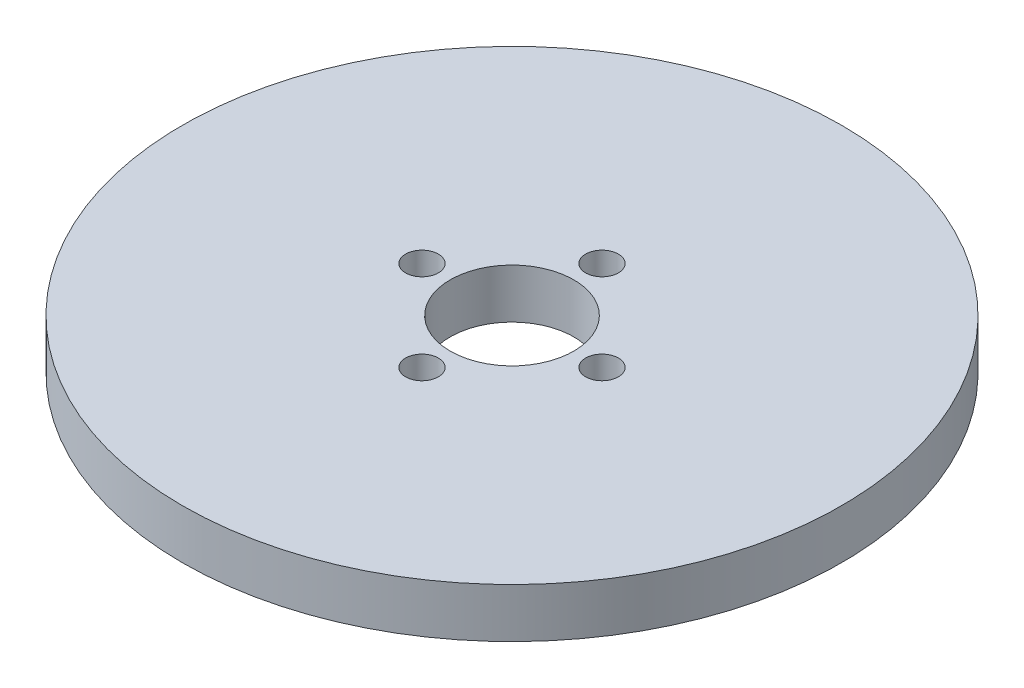
from build123d import *

# Parameters (mm, degrees)
SKETCH1_R           = 40
BOSS_EXTRUDE1_DEPTH = 6
SKETCH2_R           = 7.5
CUT_EXTRUDE1_DEPTH  = 57.885850613
SKETCH3_R           = 1.985908738
CUT_EXTRUDE2_DEPTH  = 4.953598815
CIRPATTERN1_COUNT   = 4


with BuildPart() as part:
    # Sketch1 → Boss-Extrude1 (new body)
    with BuildSketch(Plane(origin=(0, 0, 0), x_dir=(1, 0, 0), z_dir=(0, 1, 0))):
        Circle(SKETCH1_R)
    extrude(amount=BOSS_EXTRUDE1_DEPTH)

    # Sketch2 → Cut-Extrude1 (cut, through all)
    with BuildSketch(Plane(origin=(0, 0, 0), x_dir=(1, 0, 0), z_dir=(0, 1, 0))):
        Circle(SKETCH2_R)
    extrude(amount=CUT_EXTRUDE1_DEPTH, mode=Mode.SUBTRACT)

    # Sketch3 → Cut-Extrude2 (cut)
    with BuildSketch(Plane(origin=(0, 6, 0), x_dir=(1, 0, 0), z_dir=(0, 1, 0))):
        with Locations((-10.925595865, 0)):
            Circle(SKETCH3_R)
    cut_extrude2 = extrude(amount=-CUT_EXTRUDE2_DEPTH, mode=Mode.SUBTRACT)

    # CirPattern1: Cut-Extrude2 ×4 about axis
    cirpattern1_axis = Axis((0, 0, 0), (0, 1, 0))
    for i in range(1, CIRPATTERN1_COUNT):
        add(cut_extrude2.rotate(cirpattern1_axis, i * 360 / CIRPATTERN1_COUNT), mode=Mode.SUBTRACT)


solid = part.part
